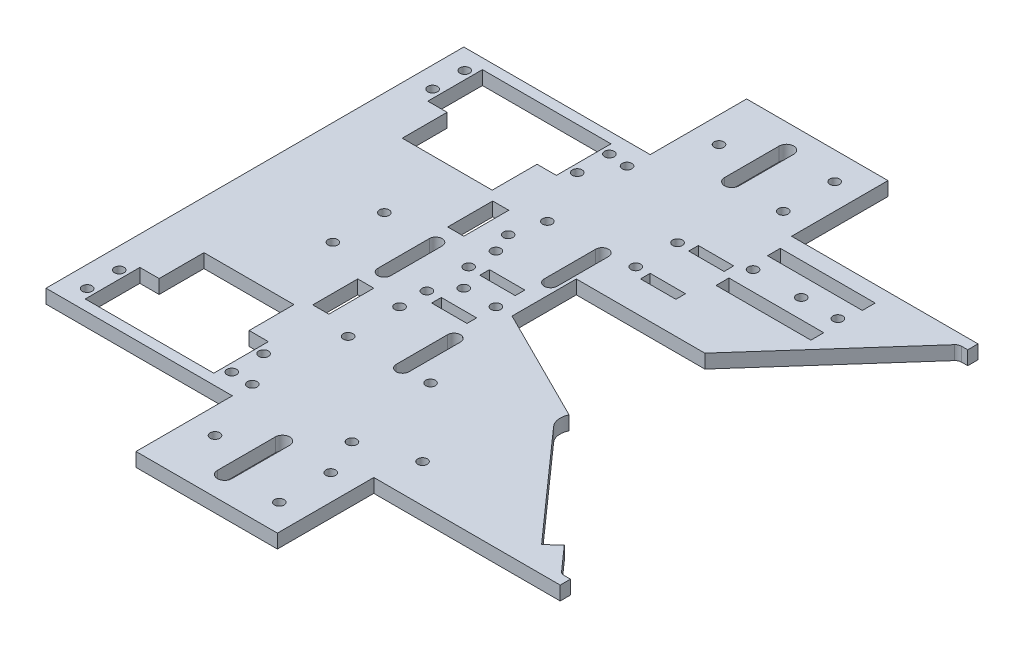
from build123d import *

# Parameters (mm, degrees)
BOSS_EXTRUDE1_DEPTH = 4.3
CUT_EXTRUDE1_DEPTH  = 4.5
FILLET1_R           = 2
CUT_EXTRUDE2_DEPTH  = 10
SKETCH8_R           = 1.5
CUT_EXTRUDE3_DEPTH  = 10
SKETCH9_R           = 1.5
CUT_EXTRUDE4_DEPTH  = 10
CUT_EXTRUDE5_DEPTH  = 10
SKETCH11_R          = 1.5
CUT_EXTRUDE6_DEPTH  = 10
SKETCH12_R          = 1.5
CUT_EXTRUDE7_DEPTH  = 10
SKETCH7_R           = 1.5
SKETCH7_W           = 11
SKETCH7_H           = 3
CUT_EXTRUDE8_DEPTH  = 9
SKETCH13_R          = 1.5
CUT_EXTRUDE9_DEPTH  = 10
SKETCH14_R          = 1.5
CUT_EXTRUDE10_DEPTH = 10
SKETCH15_W          = 5
SKETCH15_H          = 14
CUT_EXTRUDE11_DEPTH = 10
SKETCH16_R          = 1.5
CUT_EXTRUDE12_DEPTH = 10
SKETCH18_R          = 1.5
SKETCH18_W          = 29.5
SKETCH18_H          = 4
CUT_EXTRUDE13_DEPTH = 10


with BuildPart() as part:
    # Sketch2 → Boss-Extrude1 (new body)
    with BuildSketch(Plane(origin=(0, 0, 0), x_dir=(1, 0, 0), z_dir=(0, 1, 0))):
        Polygon((0, 0), (0, 65), (58, 65), (58, 95), (102, 95), (102, 65), (160, 65), (160, 0), align=None)
    extrude(amount=BOSS_EXTRUDE1_DEPTH)

    # Mirror1: part across plane


with BuildPart() as part_1:
    add(part.part)
    add(part.part.mirror(Plane(origin=(0, 4.3, 0), x_dir=(1, 0, 0), z_dir=(0, 0, -1))))

    # Sketch3 → Cut-Extrude1 (cut)
    with BuildSketch(Plane(origin=(0, 4.3, 0), x_dir=(1, 0, 0), z_dir=(0, 1, 0))):
        Polygon((160, -61.8), (160, 61.8), (157.156451185, 61.8), (120.012594795, 20), (80.012594795, 20), (80.012594795, 0), (120, -20), (157.155555556, -61.8), align=None)
    extrude(amount=-CUT_EXTRUDE1_DEPTH, mode=Mode.SUBTRACT)

    # Fillet1
    fillet1_edges = [part_1.edges().sort_by_distance(p)[0] for p in [
        (157.156451185, 2.15, -61.8),
        (157.155555556, 2.15, 61.8),
    ]]
    fillet(fillet1_edges, radius=FILLET1_R)

    # Sketch6 → Cut-Extrude2 (cut)
    with BuildSketch(Plane(origin=(0, 4.3, 0), x_dir=(1, 0, 0), z_dir=(0, 1, 0))):
        Polygon((9, -61.8), (49, -61.8), (49, -44.8), (43, -44.8), (43, -30.841820122), (15, -30.841820122), (15, -44.8), (9, -44.8), align=None)
        Polygon((9, 44.8), (15, 44.8), (15, 30.841820122), (43, 30.841820122), (43, 44.8), (49, 44.8), (49, 61.8), (9, 61.8), align=None)
    extrude(amount=-CUT_EXTRUDE2_DEPTH, mode=Mode.SUBTRACT)

    # Sketch8 → Cut-Extrude3 (cut)
    with BuildSketch(Plane(origin=(0, 4.3, 0), x_dir=(1, 0, 0), z_dir=(0, 1, 0))):
        with Locations((6.5, 58.8)):
            Circle(SKETCH8_R)
        with Locations((6.5, 48.8)):
            Circle(SKETCH8_R)
        with Locations((51.5, 48.8)):
            Circle(SKETCH8_R)
        with Locations((51.5, 58.8)):
            Circle(SKETCH8_R)
        with Locations((6.5, -48.7)):
            Circle(SKETCH8_R)
        with Locations((6.5, -58.7)):
            Circle(SKETCH8_R)
        with Locations((51.5, -58.7)):
            Circle(SKETCH8_R)
        with Locations((51.5, -48.8)):
            Circle(SKETCH8_R)
    extrude(amount=-CUT_EXTRUDE3_DEPTH, mode=Mode.SUBTRACT)

    # Sketch9 → Cut-Extrude4 (cut)
    with BuildSketch(Plane.XZ):
        with Locations((94, 70.4)):
            Circle(SKETCH9_R)
        with Locations((66, 78.4)):
            Circle(SKETCH9_R)
        with Locations((66, -78.4)):
            Circle(SKETCH9_R)
        with Locations((94, -86.4)):
            Circle(SKETCH9_R)
        with Locations((94, 86.4)):
            Circle(SKETCH9_R)
        with Locations((94, -70.4)):
            Circle(SKETCH9_R)
        with BuildLine():
            Line((75.75, 69.4), (75.75, 87.4))
            ThreePointArc((75.75, 87.4), (78, 89.65), (80.25, 87.4))
            Line((80.25, 87.4), (80.25, 69.4))
            ThreePointArc((80.25, 69.4), (78, 67.15), (75.75, 69.4))
        make_face()
        with BuildLine():
            Line((75.75, -87.4), (75.75, -70.4))
            ThreePointArc((75.75, -70.4), (78, -68.15), (80.25, -70.4))
            Line((80.25, -70.4), (80.25, -87.4))
            ThreePointArc((80.25, -87.4), (78, -89.65), (75.75, -87.4))
        make_face()
    extrude(amount=-CUT_EXTRUDE4_DEPTH, mode=Mode.SUBTRACT)

    # Sketch10 → Cut-Extrude5 (cut)
    with BuildSketch(Plane(origin=(0, 4.3, 0), x_dir=(1, 0, 0), z_dir=(0, 1, 0))):
        with BuildLine():
            Line((123.321819194, -23.737046593), (149.896372747, -53.633419341))
            Line((149.896372747, -53.633419341), (146.159326154, -56.955238535))
            Line((146.159326154, -56.955238535), (116.262953407, -23.321819194))
            ThreePointArc((116.262953407, -23.321819194), (120.29361011, -15.008628134), (123.321819194, -23.737046593))
        make_face()
    extrude(amount=-CUT_EXTRUDE5_DEPTH, mode=Mode.SUBTRACT)

    # Sketch11 → Cut-Extrude6 (cut)
    with BuildSketch(Plane.XZ):
        with BuildLine():
            ThreePointArc((79, 31.031280577), (77, 33.031280577), (75, 31.031280577))
            Line((75, 31.031280577), (75, 15.031280577))
            ThreePointArc((75, 15.031280577), (77, 13.031280577), (79, 15.031280577))
            Line((79, 15.031280577), (79, 31.031280577))
        make_face()
        with BuildLine():
            ThreePointArc((75, -31.031280577), (77, -33.031280577), (79, -31.031280577))
            Line((79, -31.031280577), (79, -15.031280577))
            ThreePointArc((79, -15.031280577), (77, -13.031280577), (75, -15.031280577))
            Line((75, -15.031280577), (75, -31.031280577))
        make_face()
        with Locations((60, 31)):
            Circle(SKETCH11_R)
        with Locations((60, 15)):
            Circle(SKETCH11_R)
        with Locations((60, -15)):
            Circle(SKETCH11_R)
        with Locations((60, -31)):
            Circle(SKETCH11_R)
    extrude(amount=-CUT_EXTRUDE6_DEPTH, mode=Mode.SUBTRACT)

    # Sketch12 → Cut-Extrude7 (cut)
    with BuildSketch(Plane(origin=(0, 0, 0), x_dir=(-1, 0, 0), z_dir=(0, -1, 0))):
        with BuildLine():
            ThreePointArc((-50.262723036, -8), (-48.262723036, -10), (-46.262723036, -8))
            Line((-46.262723036, -8), (-46.262723036, 8))
            ThreePointArc((-46.262723036, 8), (-48.262723036, 10), (-50.262723036, 8))
            Line((-50.262723036, 8), (-50.262723036, -8))
        make_face()
        with Locations((-32.262723036, -8)):
            Circle(SKETCH12_R)
        with Locations((-32.262723036, 8)):
            Circle(SKETCH12_R)
    extrude(amount=-CUT_EXTRUDE7_DEPTH, mode=Mode.SUBTRACT)

    # Sketch7 → Cut-Extrude8 (cut)
    with BuildSketch(Plane(origin=(0, 4.3, 0), x_dir=(1, 0, 0), z_dir=(0, 1, 0))):
        with Locations((60.012594795, -6.5)):
            Circle(SKETCH7_R)
        with Locations((60.012594795, 6.5)):
            Circle(SKETCH7_R)
        with Locations((86, 32.5)):
            Circle(SKETCH7_R)
        with Locations((86, 45.5)):
            Circle(SKETCH7_R)
        with Locations((69.5, -7.5)):
            Rectangle(SKETCH7_W, SKETCH7_H)
        with Locations((69.5, 7.5)):
            Rectangle(SKETCH7_W, SKETCH7_H)
        with Locations((95.487405205, 31.5)):
            Rectangle(SKETCH7_W, SKETCH7_H)
        with Locations((95.487405205, 46.5)):
            Rectangle(SKETCH7_W, SKETCH7_H)
    extrude(amount=-CUT_EXTRUDE8_DEPTH, mode=Mode.SUBTRACT)

    # Sketch13 → Cut-Extrude9 (cut)
    with BuildSketch(Plane(origin=(0, 4.3, 0), x_dir=(1, 0, 0), z_dir=(0, 1, 0))):
        with Locations((75, 0)):
            Circle(SKETCH13_R)
        with Locations((65, 0)):
            Circle(SKETCH13_R)
    extrude(amount=-CUT_EXTRUDE9_DEPTH, mode=Mode.SUBTRACT)

    # Sketch14 → Cut-Extrude10 (cut)
    with BuildSketch(Plane(origin=(0, 4.3, 0), x_dir=(1, 0, 0), z_dir=(0, 1, 0))):
        with Locations((57.5, 58.3)):
            Circle(SKETCH14_R)
        with Locations((57.5, 21.3)):
            Circle(SKETCH14_R)
        with Locations((85.370034901, -30.712866901)):
            Circle(SKETCH14_R)
        with Locations((105.300950066, -53.135146462)):
            Circle(SKETCH14_R)
    extrude(amount=-CUT_EXTRUDE10_DEPTH, mode=Mode.SUBTRACT)

    # Sketch15 → Cut-Extrude11 (cut)
    with BuildSketch(Plane(origin=(0, 4.3, 0), x_dir=(1, 0, 0), z_dir=(0, 1, 0))):
        with Locations((48.5, 21)):
            Rectangle(SKETCH15_W, SKETCH15_H)
        with Locations((48.5, -21)):
            Rectangle(SKETCH15_W, SKETCH15_H)
    extrude(amount=-CUT_EXTRUDE11_DEPTH, mode=Mode.SUBTRACT)

    # Sketch16 → Cut-Extrude12 (cut)
    with BuildSketch(Plane(origin=(0, 4.3, 0), x_dir=(1, 0, 0), z_dir=(0, 1, 0))):
        with Locations((89, -58.8)):
            Circle(SKETCH16_R)
        with Locations((58, -58.8)):
            Circle(SKETCH16_R)
    extrude(amount=-CUT_EXTRUDE12_DEPTH, mode=Mode.SUBTRACT)

    # Sketch18 → Cut-Extrude13 (cut)
    with BuildSketch(Plane(origin=(0, 4.3, 0), x_dir=(1, 0, 0), z_dir=(0, 1, 0))):
        with Locations((131.4, 50)):
            Circle(SKETCH18_R)
        with Locations((120, 50)):
            Circle(SKETCH18_R)
        with Locations((105, 50)):
            Circle(SKETCH18_R)
        with Locations((118.25, 58)):
            Rectangle(SKETCH18_W, SKETCH18_H)
        with Locations((118.25, 42)):
            Rectangle(SKETCH18_W, SKETCH18_H)
    extrude(amount=-CUT_EXTRUDE13_DEPTH, mode=Mode.SUBTRACT)


solid = part_1.part
